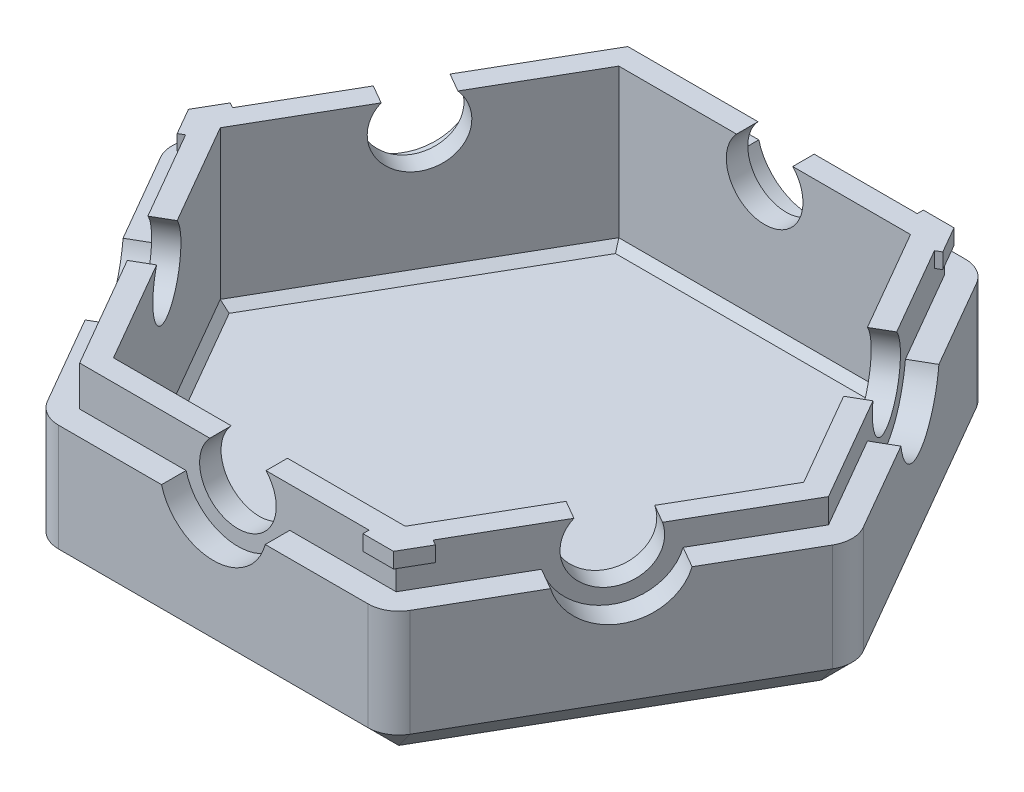
from build123d import *

# Parameters (mm, degrees)
BOSS_EXTRUDE1_START = -3.7
BOSS_EXTRUDE1_DEPTH = 10
CUT_EXTRUDE1_DEPTH  = 8.6
BOSS_EXTRUDE2_DEPTH = 1.6
FILLET1_R           = 2
CUT_EXTRUDE4_START  = -1
CUT_EXTRUDE4_DEPTH  = 1
CUT_EXTRUDE3_REACH  = 48.892
SKETCH4_R           = 3.5
CIRPATTERN1_COUNT   = 6
CHAMFER1_SIZE       = 0.5
CHAMFER2_SIZE       = 2
BOSS_EXTRUDE3_DEPTH = 1
BOSS_EXTRUDE4_DEPTH = 1.4
CIRPATTERN5_COUNT   = 6
CUT_EXTRUDE5_DEPTH  = 1


with BuildPart() as part:
    # Sketch1 → Boss-Extrude1 (new body)
    with BuildSketch(Plane(origin=(0, 0, 0), x_dir=(1, 0, 0), z_dir=(0, 1, 0)).offset(BOSS_EXTRUDE1_START)):
        Polygon((22.5, 0), (11.25, 19.485571585), (-11.25, 19.485571585), (-22.5, 0), (-11.25, -19.485571585), (11.25, -19.485571585), align=None)
    extrude(amount=-BOSS_EXTRUDE1_DEPTH)

    # Sketch2 → Cut-Extrude1 (cut)
    with BuildSketch(Plane(origin=(0, -3.7, 0), x_dir=(1, 0, 0), z_dir=(0, 1, 0))):
        Polygon((9.517949192, -16.485571585), (19.035898385, 0), (9.517949192, 16.485571585), (-9.517949192, 16.485571585), (-19.035898385, 0), (-9.517949192, -16.485571585), align=None)
    extrude(amount=-CUT_EXTRUDE1_DEPTH, mode=Mode.SUBTRACT)

    # Sketch3 → Boss-Extrude2 (add)
    with BuildSketch(Plane(origin=(0, -3.7, 0), x_dir=(1, 0, 0), z_dir=(0, 1, 0))):
        Polygon((10.326239569, -17.885571585), (20.652479139, 0), (10.326239569, 17.885571585), (-10.326239569, 17.885571585), (-20.652479139, 0), (-10.326239569, -17.885571585), align=None)
        Polygon((-9.517949192, -16.485571585), (9.517949192, -16.485571585), (19.035898385, 0), (9.517949192, 16.485571585), (-9.517949192, 16.485571585), (-19.035898385, 0), align=None, mode=Mode.SUBTRACT)
    extrude(amount=BOSS_EXTRUDE2_DEPTH)

    # Fillet1
    fillet1_edges = [part.edges().sort_by_distance(p)[0] for p in [
        (22.5, -8.7, 0),
        (11.25, -8.7, 19.485571585),
        (-11.25, -8.7, 19.485571585),
        (-22.5, -8.7, 0),
        (-11.25, -8.7, -19.485571585),
        (11.25, -8.7, -19.485571585),
    ]]
    fillet(fillet1_edges, radius=FILLET1_R)

    # Sketch6 → Cut-Extrude4 (cut)
    with BuildSketch(Plane(origin=(0, -3.7, 0), x_dir=(1, 0, 0), z_dir=(0, 1, 0)).offset(CUT_EXTRUDE4_START)):
        with BuildLine():
            Line((11.827350269, -18.485571585), (21.922649731, -1))
            ThreePointArc((21.922649731, -1), (22.190598923, 0), (21.922649731, 1))
            Line((21.922649731, 1), (11.827350269, 18.485571585))
            ThreePointArc((11.827350269, 18.485571585), (11.095299462, 19.217622393), (10.095299462, 19.485571585))
            Line((10.095299462, 19.485571585), (-10.095299462, 19.485571585))
            ThreePointArc((-10.095299462, 19.485571585), (-11.095299462, 19.217622393), (-11.827350269, 18.485571585))
            Line((-11.827350269, 18.485571585), (-21.922649731, 1))
            ThreePointArc((-21.922649731, 1), (-22.190598923, 0), (-21.922649731, -1))
            Line((-21.922649731, -1), (-11.827350269, -18.485571585))
            ThreePointArc((-11.827350269, -18.485571585), (-11.095299462, -19.217622393), (-10.095299462, -19.485571585))
            Line((-10.095299462, -19.485571585), (10.095299462, -19.485571585))
            ThreePointArc((10.095299462, -19.485571585), (11.095299462, -19.217622393), (11.827350269, -18.485571585))
        make_face()
        Polygon((10.326239569, -17.885571585), (20.652479139, 0), (10.326239569, 17.885571585), (-10.326239569, 17.885571585), (-20.652479139, 0), (-10.326239569, -17.885571585), align=None, mode=Mode.SUBTRACT)
    extrude(amount=CUT_EXTRUDE4_DEPTH, mode=Mode.SUBTRACT)

    # Sketch4 → Cut-Extrude3 (cut, up to next)
    with BuildSketch(Plane(origin=(0, 0, -19.485571585), x_dir=(-1, 0, 0), z_dir=(0, 0, -1)), mode=Mode.PRIVATE) as cut_extrude3_sk1:
        with Locations((0, -3.8)):
            Circle(SKETCH4_R)
    cut_extrude3_tool1 = extrude(cut_extrude3_sk1.sketch, amount=-CUT_EXTRUDE3_REACH, mode=Mode.PRIVATE) & part.part
    cut_extrude3 = cut_extrude3_tool1.solids().sort_by_distance((0, -3.8, -19.485572))[0]
    add(cut_extrude3, mode=Mode.SUBTRACT)

    # CirPattern1: Cut-Extrude3 ×6 about axis
    cirpattern1_axis = Axis((0, -14.28, 0), (0, 1, 0))
    for i in range(1, CIRPATTERN1_COUNT):
        add(cut_extrude3.rotate(cirpattern1_axis, i * 360 / CIRPATTERN1_COUNT), mode=Mode.SUBTRACT)

    # Chamfer1
    chamfer1_edges = [part.edges().sort_by_distance(p)[0] for p in [
        (-14.276923789, -12.3, 8.242785793),
        (-14.276923789, -12.3, -8.242785793),
        (0, -12.3, -16.485571585),
        (14.276923789, -12.3, -8.242785793),
        (14.276923789, -12.3, 8.242785793),
        (0, -12.3, 16.485571585),
    ]]
    chamfer(chamfer1_edges, length=CHAMFER1_SIZE)

    # Chamfer2
    chamfer2_edges = [part.edges().sort_by_distance(p)[0] for p in [
        (0, -13.7, 19.485571585),
        (11.095299462, -13.7, 19.217622393),
        (-11.095299462, -13.7, 19.217622393),
        (16.875, -13.7, 9.742785793),
        (-16.875, -13.7, 9.742785793),
        (22.190598923, -13.7, 0),
        (-22.190598923, -13.7, 0),
        (16.875, -13.7, -9.742785793),
        (-16.875, -13.7, -9.742785793),
        (11.095299462, -13.7, -19.217622393),
        (-11.095299462, -13.7, -19.217622393),
        (0, -13.7, -19.485571585),
    ]]
    chamfer(chamfer2_edges, length=CHAMFER2_SIZE)

    # Sketch7 → Boss-Extrude3 (add)
    with BuildSketch(Plane(origin=(0, -2.1, 0), x_dir=(1, 0, 0), z_dir=(0, 1, 0))):
        Polygon((8.557179677, 17.885571585), (8.557179677, 18.285571585), (10.557179677, 18.285571585), (11.557179677, 16.553520778), (11.210769515, 16.353520778), (10.326239569, 17.885571585), align=None)
        Polygon((8.557179677, -18.285571585), (10.557179677, -18.285571585), (11.557179677, -16.553520778), (11.210769515, -16.353520778), (10.326239569, -17.885571585), (8.557179677, -17.885571585), align=None)
        Polygon((-20.114359354, 1.732050808), (-21.114359354, 0), (-20.114359354, -1.732050808), (-19.767949192, -1.532050808), (-20.652479139, 0), (-19.767949192, 1.532050808), align=None)
    extrude(amount=-BOSS_EXTRUDE3_DEPTH)

    # Sketch10 → Boss-Extrude4 (add)
    with BuildSketch(Plane.XY.offset(-16.485571585)):
        with BuildLine():
            Line((3.059411708, -2.1), (1.833030278, -2.1))
            ThreePointArc((1.833030278, -2.1), (0, -6.3), (-1.833030278, -2.1))
            Line((-1.833030278, -2.1), (-3.059411708, -2.1))
            ThreePointArc((-3.059411708, -2.1), (0, -7.3), (3.059411708, -2.1))
        make_face()
    boss_extrude4 = extrude(amount=-BOSS_EXTRUDE4_DEPTH)

    # CirPattern5: Boss-Extrude4 ×6 about axis
    cirpattern5_axis = Axis((0, -14.28, 0), (0, 1, 0))
    for i in range(1, CIRPATTERN5_COUNT):
        add(boss_extrude4.rotate(cirpattern5_axis, i * 360 / CIRPATTERN5_COUNT))

    # Sketch9 → Cut-Extrude5 (cut)
    with BuildSketch(Plane(origin=(0, -2.1, 0), x_dir=(1, 0, 0), z_dir=(0, 1, 0))):
        Polygon((16.405874493, 7.355335006), (15.193438928, 6.655335006), (19.035898385, 0), (15.193438928, -6.655335006), (16.405874493, -7.355335006), (20.652479139, 0), align=None)
    extrude(amount=-CUT_EXTRUDE5_DEPTH, mode=Mode.SUBTRACT)


solid = part.part
